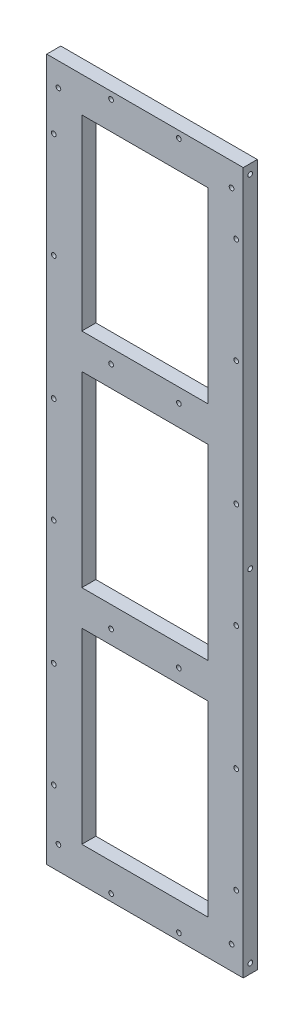
from build123d import *

# Parameters (mm, degrees)
SKETCH1_W            = 84
SKETCH1_H            = 300
SKETCH1_W_2          = 54
SKETCH1_H_2          = 80
BOSS_EXTRUDE1_DEPTH  = 6
SKETCH2_R            = 1
CUT_EXTRUDE1_DEPTH   = 10
SKETCH4_R            = 1
CUT_EXTRUDE3_DEPTH   = 10
SKETCH6_R            = 1
CUT_EXTRUDE5_DEPTH   = 10
LPATTERN1_COUNT      = 2
LPATTERN1_PITCH      = 74
LPATTERN1_COUNT_DIR2 = 2
LPATTERN1_PITCH_DIR2 = 280


with BuildPart() as part:
    # Sketch1 → Boss-Extrude1 (new body)
    with BuildSketch(Plane.XY):
        Rectangle(SKETCH1_W, SKETCH1_H)
        with Locations((0, 95)):
            Rectangle(SKETCH1_W_2, SKETCH1_H_2, mode=Mode.SUBTRACT)
        with Locations((0, -95)):
            Rectangle(SKETCH1_W_2, SKETCH1_H_2, mode=Mode.SUBTRACT)
        Rectangle(SKETCH1_W_2, SKETCH1_H_2, mode=Mode.SUBTRACT)
    extrude(amount=BOSS_EXTRUDE1_DEPTH)

    # Sketch2 → Cut-Extrude1 (cut)
    with BuildSketch(Plane(origin=(42, 0, 0), x_dir=(0, 0, -1), z_dir=(1, 0, 0))):
        with Locations((-3, 146)):
            Circle(SKETCH2_R)
        with Locations((-3, 0)):
            Circle(SKETCH2_R)
        with Locations((-3, -146)):
            Circle(SKETCH2_R)
        with Locations((-3, -292)):
            Circle(SKETCH2_R)
    cut_extrude1 = extrude(amount=-CUT_EXTRUDE1_DEPTH, mode=Mode.SUBTRACT)

    # Mirror1: Cut-Extrude1 across plane
    add(cut_extrude1.mirror(Plane(origin=(0, 0, 0), x_dir=(0, 0, 1), z_dir=(1, 0, 0))), mode=Mode.SUBTRACT)

    # Sketch4 → Cut-Extrude3 (cut)
    with BuildSketch(Plane.XY.offset(6)):
        with Locations((-14.5, 147)):
            Circle(SKETCH4_R)
        with Locations((14.5, 147)):
            Circle(SKETCH4_R)
        with Locations((-39, 122)):
            Circle(SKETCH4_R)
        with Locations((-14.5, 49)):
            Circle(SKETCH4_R)
        with Locations((14.5, 49)):
            Circle(SKETCH4_R)
        with Locations((-14.5, -49)):
            Circle(SKETCH4_R)
        with Locations((14.5, -49)):
            Circle(SKETCH4_R)
        with Locations((-14.5, -147)):
            Circle(SKETCH4_R)
        with Locations((14.5, -147)):
            Circle(SKETCH4_R)
        with Locations((39, 122)):
            Circle(SKETCH4_R)
        with Locations((39, 77)):
            Circle(SKETCH4_R)
        with Locations((-39, 77)):
            Circle(SKETCH4_R)
        with Locations((-39, 24)):
            Circle(SKETCH4_R)
        with Locations((39, 24)):
            Circle(SKETCH4_R)
        with Locations((39, -21)):
            Circle(SKETCH4_R)
        with Locations((-39, -21)):
            Circle(SKETCH4_R)
        with Locations((-39, -74)):
            Circle(SKETCH4_R)
        with Locations((39, -74)):
            Circle(SKETCH4_R)
        with Locations((39, -119)):
            Circle(SKETCH4_R)
        with Locations((-39, -119)):
            Circle(SKETCH4_R)
    extrude(amount=-CUT_EXTRUDE3_DEPTH, mode=Mode.SUBTRACT)

    # Sketch6 → Cut-Extrude5 (cut)
    with BuildSketch(Plane.XY.offset(6)):
        with Locations((-37, 140)):
            Circle(SKETCH6_R)
    cut_extrude5 = extrude(amount=-CUT_EXTRUDE5_DEPTH, mode=Mode.SUBTRACT)

    # LPattern1: Cut-Extrude5 2 × 2
    with Locations(*[(i * LPATTERN1_PITCH, -j * LPATTERN1_PITCH_DIR2, 0) for i in range(LPATTERN1_COUNT) for j in range(LPATTERN1_COUNT_DIR2) if (i, j) != (0, 0)]):
        add(cut_extrude5, mode=Mode.SUBTRACT)


solid = part.part
